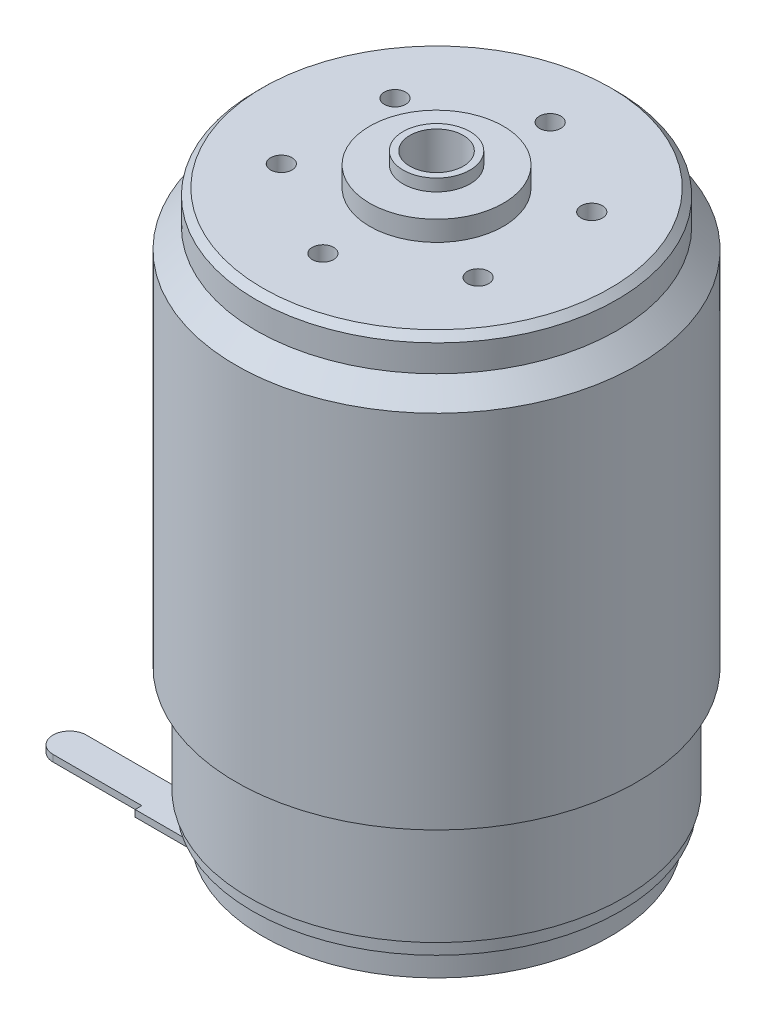
from build123d import *

# Parameters (mm, degrees)
ESQUISSE1_R             = 15
EXTRUSION1_DEPTH        = 42
ESQUISSE2_OUTSIDE_W     = 43.94
ESQUISSE2_OUTSIDE_H     = 43.94
ESQUISSE2_OUTSIDE_R     = 13.5
ENL_V_MAT_EXTRU_1_DEPTH = 4
ESQUISSE3_OUTSIDE_W     = 43.94
ESQUISSE3_OUTSIDE_H     = 43.94
ESQUISSE3_OUTSIDE_R     = 13
ENL_V_MAT_EXTRU_2_DEPTH = 2
ESQUISSE4_OUTSIDE_W     = 43.94
ESQUISSE4_OUTSIDE_H     = 43.94
ESQUISSE4_OUTSIDE_R     = 13.75
ENL_V_MAT_EXTRU_3_DEPTH = 1
ESQUISSE5_OUTSIDE_W     = 43.94
ESQUISSE5_OUTSIDE_H     = 43.94
ESQUISSE5_OUTSIDE_R     = 14
ENL_V_MAT_EXTRU_4_DEPTH = 8
CHANFREIN1_SIZE         = 0.5
CHANFREIN2_SIZE         = 1.5
ESQUISSE6_R             = 5
EXTRUSION2_DEPTH        = 1.5
EXTRUSION3_START        = 2
ESQUISSE7_R             = 5
EXTRUSION3_DEPTH        = 2
ESQUISSE8_R             = 2.5
EXTRUSION4_DEPTH        = 0.9
EXTRUSION5_START        = 0.9
ESQUISSE9_R             = 2.5
EXTRUSION5_DEPTH        = 0.9
ENL_V_MAT_EXTRU_5_REACH = 53.839
ESQUISSE10_R            = 1.5
ESQUISSE11_R            = 2
ENL_V_MAT_EXTRU_6_DEPTH = 10
TROU_TARAUD_M21_D       = 1.6
TROU_TARAUD_M21_DEPTH   = 3.2
TROU_TARAUD_M21_TIP     = 0.480688495
TROU_TARAUD_M22_D       = 1.6
TROU_TARAUD_M22_DEPTH   = 2.2
TROU_TARAUD_M22_TIP     = 0.480688495
ESQUISSE16_R            = 0.75
EXTRUSION6_DEPTH        = 0.5


with BuildPart() as part:
    # Esquisse1 → Extrusion1 (new body)
    with BuildSketch(Plane(origin=(0, 0, 0), x_dir=(1, 0, 0), z_dir=(0, 1, 0))):
        with Locations(Location((0, 0, 0), (0, 0, 90))):
            Circle(ESQUISSE1_R)
    extrude(amount=EXTRUSION1_DEPTH)

    # Esquisse2 outside → Enlèv. mat.-Extru.1 (cut)
    with BuildSketch(Plane(origin=(0, 42, 0), x_dir=(1, 0, 0), z_dir=(0, 1, 0))):
        Rectangle(ESQUISSE2_OUTSIDE_W, ESQUISSE2_OUTSIDE_H)
        with Locations(Location((0, 0, 0), (0, 0, 270))):
            Circle(ESQUISSE2_OUTSIDE_R, mode=Mode.SUBTRACT)
    extrude(amount=-ENL_V_MAT_EXTRU_1_DEPTH, mode=Mode.SUBTRACT)

    # Esquisse3 outside → Enlèv. mat.-Extru.2 (cut)
    with BuildSketch(Plane.XZ):
        Rectangle(ESQUISSE3_OUTSIDE_W, ESQUISSE3_OUTSIDE_H)
        with Locations(Location((0, 0, 0), (0, 0, 270))):
            Circle(ESQUISSE3_OUTSIDE_R, mode=Mode.SUBTRACT)
    extrude(amount=-ENL_V_MAT_EXTRU_2_DEPTH, mode=Mode.SUBTRACT)

    # Esquisse4 outside → Enlèv. mat.-Extru.3 (cut)
    with BuildSketch(Plane.XZ.offset(-2)):
        Rectangle(ESQUISSE4_OUTSIDE_W, ESQUISSE4_OUTSIDE_H)
        with Locations(Location((0, 0, 0), (0, 0, 270))):
            Circle(ESQUISSE4_OUTSIDE_R, mode=Mode.SUBTRACT)
    extrude(amount=-ENL_V_MAT_EXTRU_3_DEPTH, mode=Mode.SUBTRACT)

    # Esquisse5 outside → Enlèv. mat.-Extru.4 (cut)
    with BuildSketch(Plane.XZ.offset(-3)):
        Rectangle(ESQUISSE5_OUTSIDE_W, ESQUISSE5_OUTSIDE_H)
        with Locations(Location((0, 0, 0), (0, 0, 270))):
            Circle(ESQUISSE5_OUTSIDE_R, mode=Mode.SUBTRACT)
    extrude(amount=-ENL_V_MAT_EXTRU_4_DEPTH, mode=Mode.SUBTRACT)

    # Chanfrein1
    chanfrein1_edges = [part.edges().sort_by_distance(p)[0] for p in [
        (0, 42, -13.5),
    ]]
    chamfer(chanfrein1_edges, length=CHANFREIN1_SIZE)

    # Chanfrein2
    chanfrein2_edges = [part.edges().sort_by_distance(p)[0] for p in [
        (0, 38, -13.5),
    ]]
    chamfer(chanfrein2_edges, length=CHANFREIN2_SIZE - 0.0001)  # a hair under: the kernel refuses the full size

    # Esquisse6 → Extrusion2 (add)
    with BuildSketch(Plane(origin=(0, 42, 0), x_dir=(1, 0, 0), z_dir=(0, 1, 0))):
        with Locations(Location((0, 0, 0), (0, 0, 270))):
            Circle(ESQUISSE6_R)
    extrude(amount=EXTRUSION2_DEPTH)

    # Esquisse7 → Extrusion3 (add)
    with BuildSketch(Plane.XZ.offset(EXTRUSION3_START)):
        with Locations(Location((0, 0, 0), (0, 0, 90))):
            Circle(ESQUISSE7_R)
    extrude(amount=-EXTRUSION3_DEPTH)

    # Esquisse8 → Extrusion4 (add)
    with BuildSketch(Plane(origin=(0, 43.5, 0), x_dir=(1, 0, 0), z_dir=(0, 1, 0))):
        with Locations(Location((0, 0, 0), (0, 0, 270))):
            Circle(ESQUISSE8_R)
    extrude(amount=EXTRUSION4_DEPTH)

    # Esquisse9 → Extrusion5 (add)
    with BuildSketch(Plane.XZ.offset(2).offset(EXTRUSION5_START)):
        with Locations(Location((0, 0, 0), (0, 0, 90))):
            Circle(ESQUISSE9_R)
    extrude(amount=-EXTRUSION5_DEPTH)

    # Esquisse10 → Enlèv. mat.-Extru.5 (cut, up to next)
    with BuildSketch(Plane.XZ.offset(2.9), mode=Mode.PRIVATE) as enl_v_mat_extru_5_sk1:
        with Locations(Location((0, 0, 0), (0, 0, 270))):
            Circle(ESQUISSE10_R)
    enl_v_mat_extru_5_tool1 = extrude(enl_v_mat_extru_5_sk1.sketch, amount=-ENL_V_MAT_EXTRU_5_REACH, mode=Mode.PRIVATE) & part.part
    add(enl_v_mat_extru_5_tool1.solids().sort_by_distance((0, -2.9, 0))[0], mode=Mode.SUBTRACT)

    # Esquisse11 → Enlèv. mat.-Extru.6 (cut)
    with BuildSketch(Plane(origin=(0, 44.4, 0), x_dir=(1, 0, 0), z_dir=(0, 1, 0))):
        with Locations(Location((0, 0, 0), (0, 0, 270))):
            Circle(ESQUISSE11_R)
    extrude(amount=-ENL_V_MAT_EXTRU_6_DEPTH, mode=Mode.SUBTRACT)

    # Trou taraudé M21
    with Locations(Plane(origin=(0, 42, 0), x_dir=(-1, 0, 0), z_dir=(0, 1, 0))):
        with Locations((0, 8.5), (-7.361215932, 4.25), (-7.361215932, -4.25), (0, -8.5), (7.361215932, -4.25), (7.361215932, 4.25)):
            Hole(TROU_TARAUD_M21_D / 2, depth=TROU_TARAUD_M21_DEPTH)
            with Locations((0, 0, -(TROU_TARAUD_M21_DEPTH + TROU_TARAUD_M21_TIP / 2))):  # 118° drill point
                Cone(0, TROU_TARAUD_M21_D / 2, TROU_TARAUD_M21_TIP, mode=Mode.SUBTRACT)

    # Trou taraudé M22
    with Locations(Plane.XZ):
        with Locations((10, 0), (-10, 0)):
            Hole(TROU_TARAUD_M22_D / 2, depth=TROU_TARAUD_M22_DEPTH)
            with Locations((0, 0, -(TROU_TARAUD_M22_DEPTH + TROU_TARAUD_M22_TIP / 2))):  # 118° drill point
                Cone(0, TROU_TARAUD_M22_D / 2, TROU_TARAUD_M22_TIP, mode=Mode.SUBTRACT)

    # Esquisse16 → Extrusion6 (add)
    # profile 1 of 4: a face of its own
    with BuildSketch(Plane.XZ):
        with BuildLine():
            Line((0, 9.5), (-3, 9.5))
            Line((-3, 9.5), (-3, 6.5))
            Line((-3, 6.5), (0, 6.5))
            ThreePointArc((0, 6.5), (1.5, 8), (0, 9.5))
        make_face()
        with Locations(Location((0, 8, 0), (0, 0, 270))):
            Circle(ESQUISSE16_R, mode=Mode.SUBTRACT)
    # profile 2 of 4: a face of its own
    with BuildSketch(Plane.XZ):
        with BuildLine():
            Line((-7, 9.55), (-7, 6.55))
            Line((-7, 6.55), (-19.65, 6.55))
            ThreePointArc((-19.65, 6.55), (-20.9, 7.8), (-19.65, 9.05))
            Line((-19.65, 9.05), (-13, 9.05))
            Line((-13, 9.05), (-13, 9.55))
            Line((-13, 9.55), (-7, 9.55))
        make_face()
    # profile 3 of 4: a face of its own
    with BuildSketch(Plane.XZ):
        with BuildLine():
            Line((-13, -9.55), (-7, -9.55))
            Line((-7, -9.55), (-7, -6.55))
            Line((-7, -6.55), (-19.65, -6.55))
            ThreePointArc((-19.65, -6.55), (-20.9, -7.8), (-19.65, -9.05))
            Line((-19.65, -9.05), (-13, -9.05))
            Line((-13, -9.05), (-13, -9.55))
        make_face()
    # profile 4 of 4: a face of its own
    with BuildSketch(Plane.XZ):
        with BuildLine():
            Line((-3, -9.5), (-3, -6.5))
            Line((-3, -6.5), (0, -6.5))
            ThreePointArc((0, -6.5), (1.5, -8), (0, -9.5))
            Line((0, -9.5), (-3, -9.5))
        make_face()
        with Locations(Location((0, -8, 0), (0, 0, 90))):
            Circle(ESQUISSE16_R, mode=Mode.SUBTRACT)
    extrude(amount=EXTRUSION6_DEPTH)


solid = part.part
